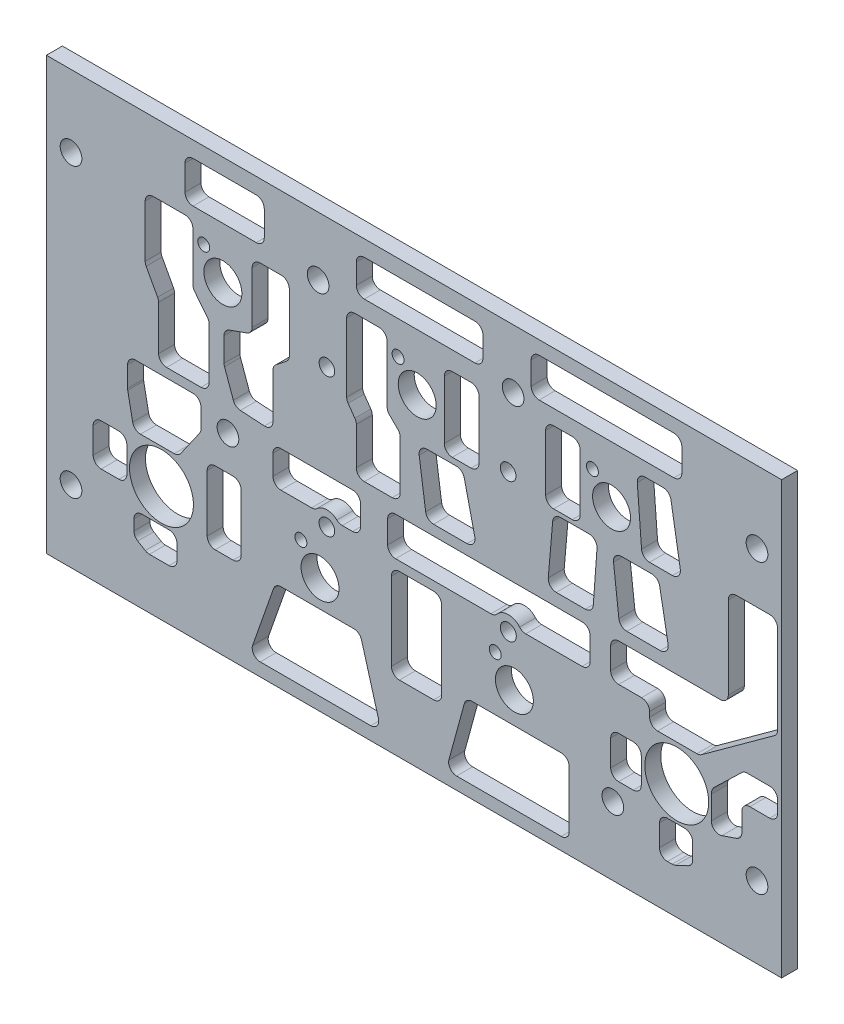
from build123d import *

# Parameters (mm, degrees)
SKETCH1_W                    = 146.05
SKETCH1_H                    = 85.725
BACKPLATE_BODY_DEPTH         = 3.175
F_6_CLEARANCE_HOLE1_D        = 4.3053
F_6_CLEARANCE_HOLE1_DEPTH    = 12.7
F_6_CLEARANCE_HOLE1_TIP      = 1.293442612
SKETCH4_R                    = 6.35
SKETCH4_R_2                  = 3.7703125
SKETCH4_R_3                  = 1.190625
SWITCH_MOUNT_HOLES_DEPTH     = 170.379629088
SKETCH6_R                    = 1.55
SKETCH6_R_2                  = 1.554753364
SKETCH6_R_3                  = 1.586123296
BACKLIGHTING_LED_HOLES_DEPTH = 170.379629088


with BuildPart() as part:
    # Sketch1 → Backplate Body (new body)
    with BuildSketch(Plane.XY):
        with Locations((-73.025, 42.8625)):
            Rectangle(SKETCH1_W, SKETCH1_H)
    extrude(amount=-BACKPLATE_BODY_DEPTH)

    # #6 Clearance Hole1
    with Locations(Plane(origin=(0, 0, -3.175), x_dir=(-1, 0, 0), z_dir=(0, 0, -1))):
        with Locations((4.8895, 71.4375), (53.34, 74.041), (92.075, 74.041), (141.1605, 71.4375), (109.982, 38.735), (141.1605, 14.2875), (33.528, 13.589), (4.8895, 14.2875)):
            Hole(F_6_CLEARANCE_HOLE1_D / 2, depth=F_6_CLEARANCE_HOLE1_DEPTH)
            with Locations((0, 0, -(F_6_CLEARANCE_HOLE1_DEPTH + F_6_CLEARANCE_HOLE1_TIP / 2))):  # 118° drill point
                Cone(0, F_6_CLEARANCE_HOLE1_D / 2, F_6_CLEARANCE_HOLE1_TIP, mode=Mode.SUBTRACT)

    # Sketch4 → Switch Mount Holes (cut, through all)
    with BuildSketch(Plane(origin=(0, 0, -3.175), x_dir=(-1, 0, 0), z_dir=(0, 0, -1))):
        with Locations((20.828, 22.987)):
            Circle(SKETCH4_R)
        with Locations((123.19, 22.987)):
            Circle(SKETCH4_R)
        with Locations((33.782, 64.135)):
            Circle(SKETCH4_R_2)
        with Locations((72.39, 64.135)):
            Circle(SKETCH4_R_2)
        with Locations((110.998, 64.135)):
            Circle(SKETCH4_R_2)
        with Locations((91.694, 22.987)):
            Circle(SKETCH4_R_2)
        with Locations((53.086, 22.987)):
            Circle(SKETCH4_R_2)
        with Locations((37.582285256, 68.778041242)):
            Circle(SKETCH4_R_3)
        with Locations((76.190285256, 68.778041242)):
            Circle(SKETCH4_R_3)
        with Locations((114.798285256, 68.778041242)):
            Circle(SKETCH4_R_3)
        with Locations((56.886285256, 27.630041242)):
            Circle(SKETCH4_R_3)
        with Locations((95.494285256, 27.630041242)):
            Circle(SKETCH4_R_3)
    extrude(amount=-SWITCH_MOUNT_HOLES_DEPTH, mode=Mode.SUBTRACT)

    # Sketch6 → Backlighting LED Holes (cut, through all)
    with BuildSketch(Plane(origin=(0, 0, -3.175), x_dir=(-1, 0, 0), z_dir=(0, 0, -1))):
        with Locations((90.3252, 59.937)):
            Circle(SKETCH6_R)
        with Locations((54.3252, 59.937)):
            Circle(SKETCH6_R)
        with Locations((90.329514846, 32.438994135)):
            Circle(SKETCH6_R_2)
        with Locations((54.290856695, 32.42580045)):
            Circle(SKETCH6_R_3)
        with BuildLine():
            Line((0.785426433, 59.749744345), (0.785426433, 42.262673755))
            ThreePointArc((0.785426433, 42.262673755), (0.958424834, 41.542020249), (1.439714906, 40.978433709))
            Line((1.439714906, 40.978433709), (15.887321534, 30.479872262))
            ThreePointArc((15.887321534, 30.479872262), (16.329908369, 30.254329655), (16.820533061, 30.176612309))
            Line((16.820533061, 30.176612309), (24.63882498, 30.176612309))
            ThreePointArc((24.63882498, 30.176612309), (25.761356995, 30.641580293), (26.22632498, 31.764112309))
            Line((26.22632498, 31.764112309), (26.22632498, 32.732935131))
            ThreePointArc((26.22632498, 32.732935131), (26.691292965, 33.855467146), (27.81382498, 34.320435131))
            Line((27.81382498, 34.320435131), (32.367304405, 34.320435131))
            ThreePointArc((32.367304405, 34.320435131), (33.48983642, 34.785403115), (33.954804405, 35.907935131))
            Line((33.954804405, 35.907935131), (33.954804405, 40.215556192))
            ThreePointArc((33.954804405, 40.215556192), (33.48983642, 41.338088207), (32.367304405, 41.803056192))
            Line((32.367304405, 41.803056192), (12.174303624, 41.803056192))
            ThreePointArc((12.174303624, 41.803056192), (11.051771609, 42.268024177), (10.586803624, 43.390556192))
            Line((10.586803624, 43.390556192), (10.586803624, 59.749744345))
            ThreePointArc((10.586803624, 59.749744345), (10.121835639, 60.872276361), (8.999303624, 61.337244345))
            Line((8.999303624, 61.337244345), (2.372926433, 61.337244345))
            ThreePointArc((2.372926433, 61.337244345), (1.250394418, 60.872276361), (0.785426433, 59.749744345))
        make_face()
        with BuildLine():
            Line((21.400023786, 75.350644356), (48.166754567, 75.350644356))
            ThreePointArc((48.166754567, 75.350644356), (49.289286582, 75.815612341), (49.754254567, 76.938144356))
            Line((49.754254567, 76.938144356), (49.754254567, 81.462446557))
            ThreePointArc((49.754254567, 81.462446557), (49.289286582, 82.584978572), (48.166754567, 83.049946557))
            Line((48.166754567, 83.049946557), (21.400023786, 83.049946557))
            ThreePointArc((21.400023786, 83.049946557), (20.277491771, 82.584978572), (19.812523786, 81.462446557))
            Line((19.812523786, 81.462446557), (19.812523786, 76.938144356))
            ThreePointArc((19.812523786, 76.938144356), (20.277491771, 75.815612341), (21.400023786, 75.350644356))
        make_face()
        with BuildLine():
            Line((59.335608416, 80.949159744), (59.335608416, 76.938144356))
            ThreePointArc((59.335608416, 76.938144356), (59.800576401, 75.815612341), (60.923108416, 75.350644356))
            Line((60.923108416, 75.350644356), (82.899162272, 75.350644356))
            ThreePointArc((82.899162272, 75.350644356), (84.021694287, 75.815612341), (84.486662272, 76.938144356))
            Line((84.486662272, 76.938144356), (84.486662272, 80.949159744))
            ThreePointArc((84.486662272, 80.949159744), (84.021694287, 82.071691759), (82.899162272, 82.536659744))
            Line((82.899162272, 82.536659744), (60.923108416, 82.536659744))
            ThreePointArc((60.923108416, 82.536659744), (59.800576401, 82.071691759), (59.335608416, 80.949159744))
        make_face()
        with BuildLine():
            Line((28.672038794, 70.907405635), (27.827187397, 59.864083676))
            ThreePointArc((27.827187397, 59.864083676), (27.323181945, 58.820620008), (26.244312737, 58.39767893))
            Line((26.244312737, 58.39767893), (21.689837718, 58.39767893))
            ThreePointArc((21.689837718, 58.39767893), (20.477644793, 58.960120608), (20.124397158, 60.248906253))
            Line((20.124397158, 60.248906253), (21.984848336, 71.292228211))
            ThreePointArc((21.984848336, 71.292228211), (22.525230575, 72.240693813), (23.550288897, 72.616000888))
            Line((23.550288897, 72.616000888), (27.089164134, 72.616000888))
            ThreePointArc((27.089164134, 72.616000888), (28.253723056, 72.107370096), (28.672038794, 70.907405635))
        make_face()
        with BuildLine():
            Line((46.876657313, 70.768971278), (46.876657313, 59.657488306))
            ThreePointArc((46.876657313, 59.657488306), (46.411689328, 58.534956291), (45.289157313, 58.069988306))
            Line((45.289157313, 58.069988306), (41.589305112, 58.069988306))
            ThreePointArc((41.589305112, 58.069988306), (40.466773097, 58.534956291), (40.001805112, 59.657488306))
            Line((40.001805112, 59.657488306), (40.001805112, 70.768971278))
            ThreePointArc((40.001805112, 70.768971278), (40.466773097, 71.891503293), (41.589305112, 72.356471278))
            Line((41.589305112, 72.356471278), (45.289157313, 72.356471278))
            ThreePointArc((45.289157313, 72.356471278), (46.411689328, 71.891503293), (46.876657313, 70.768971278))
        make_face()
        with BuildLine():
            Line((38.257624234, 57.278936968), (43.899609621, 57.278936968))
            ThreePointArc((43.899609621, 57.278936968), (44.972919639, 56.861121479), (45.481258886, 55.827605448))
            Line((45.481258886, 55.827605448), (46.355042782, 45.678269417))
            ThreePointArc((46.355042782, 45.678269417), (45.943078029, 44.46879092), (44.773393518, 43.954600938))
            Line((44.773393518, 43.954600938), (38.996979839, 43.954600938))
            ThreePointArc((38.996979839, 43.954600938), (37.915995587, 44.379505008), (37.413675408, 45.42676088))
            Line((37.413675408, 45.42676088), (36.674319803, 55.57609691))
            ThreePointArc((36.674319803, 55.57609691), (37.095028304, 56.77242122), (38.257624234, 57.278936968))
        make_face()
        with BuildLine():
            Line((24.219405423, 55.322692813), (22.548618943, 46.144830152))
            ThreePointArc((22.548618943, 46.144830152), (22.891532306, 44.843453603), (24.110449966, 44.273006203))
            Line((24.110449966, 44.273006203), (30.755280984, 44.273006203))
            ThreePointArc((30.755280984, 44.273006203), (31.811296344, 44.675184386), (32.3322486, 45.67794282))
            Line((32.3322486, 45.67794282), (33.394757201, 54.855805481))
            ThreePointArc((33.394757201, 54.855805481), (33.003111402, 56.094384224), (31.817789585, 56.625868864))
            Line((31.817789585, 56.625868864), (25.781236445, 56.625868864))
            ThreePointArc((25.781236445, 56.625868864), (24.764183846, 56.257286523), (24.219405423, 55.322692813))
        make_face()
        with BuildLine():
            Line((61.696291351, 71.619042996), (65.423676389, 71.619042996))
            ThreePointArc((65.423676389, 71.619042996), (66.546208404, 71.154075011), (67.011176389, 70.031542996))
            Line((67.011176389, 70.031542996), (67.011176389, 58.459819075))
            ThreePointArc((67.011176389, 58.459819075), (66.546208404, 57.337287059), (65.423676389, 56.872319075))
            Line((65.423676389, 56.872319075), (61.696291351, 56.872319075))
            ThreePointArc((61.696291351, 56.872319075), (60.573759336, 57.337287059), (60.108791351, 58.459819075))
            Line((60.108791351, 58.459819075), (60.108791351, 70.031542996))
            ThreePointArc((60.108791351, 70.031542996), (60.573759336, 71.154075011), (61.696291351, 71.619042996))
        make_face()
        with BuildLine():
            Line((78.368407935, 70.36568954), (78.368407935, 59.05524296))
            ThreePointArc((78.368407935, 59.05524296), (78.247566693, 58.447733011), (77.90343995, 57.932710945))
            Line((77.90343995, 57.932710945), (76.230642306, 56.259913301))
            ThreePointArc((76.230642306, 56.259913301), (75.886515563, 55.744891235), (75.765674321, 55.137381286))
            Line((75.765674321, 55.137381286), (75.765674321, 45.542100938))
            ThreePointArc((75.765674321, 45.542100938), (76.230642306, 44.419568923), (77.353174321, 43.954600938))
            Line((77.353174321, 43.954600938), (82.899162272, 43.954600938))
            ThreePointArc((82.899162272, 43.954600938), (84.021694287, 44.419568923), (84.486662272, 45.542100938))
            Line((84.486662272, 45.542100938), (84.486662272, 52.998183864))
            ThreePointArc((84.486662272, 52.998183864), (84.560211531, 53.475791866), (84.774044197, 53.909144479))
            Line((84.774044197, 53.909144479), (86.112563646, 55.819472215))
            ThreePointArc((86.112563646, 55.819472215), (86.326396312, 56.252824828), (86.399945571, 56.730432829))
            Line((86.399945571, 56.730432829), (86.399945571, 70.36568954))
            ThreePointArc((86.399945571, 70.36568954), (85.934977586, 71.488221555), (84.812445571, 71.95318954))
            Line((84.812445571, 71.95318954), (79.955907935, 71.95318954))
            ThreePointArc((79.955907935, 71.95318954), (78.83337592, 71.488221555), (78.368407935, 70.36568954))
        make_face()
        with BuildLine():
            Line((64.588095544, 55.752113711), (70.427150872, 55.752113711))
            ThreePointArc((70.427150872, 55.752113711), (71.625875842, 55.205389718), (71.998935675, 53.941793643))
            Line((71.998935675, 53.941793643), (70.710255392, 44.851373271))
            ThreePointArc((70.710255392, 44.851373271), (70.179246596, 43.875468368), (69.138470589, 43.486693338))
            Line((69.138470589, 43.486693338), (62.498343735, 43.486693338))
            ThreePointArc((62.498343735, 43.486693338), (61.256414725, 44.085371522), (60.951198538, 45.429858901))
            Line((60.951198538, 45.429858901), (63.040950348, 54.520279273))
            ThreePointArc((63.040950348, 54.520279273), (63.599273728, 55.406542721), (64.588095544, 55.752113711))
        make_face()
        with BuildLine():
            Line((104.361744188, 82.536659744), (116.930573023, 82.536659744))
            ThreePointArc((116.930573023, 82.536659744), (118.053105038, 82.071691759), (118.518073023, 80.949159744))
            Line((118.518073023, 80.949159744), (118.518073023, 75.923861258))
            ThreePointArc((118.518073023, 75.923861258), (118.053105038, 74.801329243), (116.930573023, 74.336361258))
            Line((116.930573023, 74.336361258), (104.361744188, 74.336361258))
            ThreePointArc((104.361744188, 74.336361258), (103.239212173, 74.801329243), (102.774244188, 75.923861258))
            Line((102.774244188, 75.923861258), (102.774244188, 80.949159744))
            ThreePointArc((102.774244188, 80.949159744), (103.239212173, 82.071691759), (104.361744188, 82.536659744))
        make_face()
        with BuildLine():
            Line((116.95152289, 70.450832848), (116.95152289, 60.794979539))
            ThreePointArc((116.95152289, 60.794979539), (116.861825101, 60.268914157), (116.602868041, 59.80229684))
            Line((116.602868041, 59.80229684), (114.088749966, 56.664735371))
            ThreePointArc((114.088749966, 56.664735371), (113.829792906, 56.198118054), (113.740095118, 55.672052672))
            Line((113.740095118, 55.672052672), (113.740095118, 45.542100938))
            ThreePointArc((113.740095118, 45.542100938), (114.205063103, 44.419568923), (115.327595118, 43.954600938))
            Line((115.327595118, 43.954600938), (122.178515967, 43.954600938))
            ThreePointArc((122.178515967, 43.954600938), (123.301047983, 44.419568923), (123.766015967, 45.542100938))
            Line((123.766015967, 45.542100938), (123.766015967, 54.374328078))
            ThreePointArc((123.766015967, 54.374328078), (123.814740935, 54.764619826), (123.957924816, 55.130953208))
            Line((123.957924816, 55.130953208), (126.237242345, 59.335142635))
            ThreePointArc((126.237242345, 59.335142635), (126.380426226, 59.701476017), (126.429151193, 60.091767765))
            Line((126.429151193, 60.091767765), (126.429151193, 70.450832848))
            ThreePointArc((126.429151193, 70.450832848), (125.964183208, 71.573364863), (124.841651193, 72.038332848))
            Line((124.841651193, 72.038332848), (118.53902289, 72.038332848))
            ThreePointArc((118.53902289, 72.038332848), (117.416490875, 71.573364863), (116.95152289, 70.450832848))
        make_face()
        with BuildLine():
            Line((105.172177173, 69.626168048), (105.172177173, 59.350951298))
            ThreePointArc((105.172177173, 59.350951298), (105.461527092, 58.437188409), (106.22409858, 57.856524378))
            Line((106.22409858, 57.856524378), (109.711728458, 56.606613876))
            ThreePointArc((109.711728458, 56.606613876), (110.474299946, 56.025949844), (110.763649865, 55.112186955))
            Line((110.763649865, 55.112186955), (110.763649865, 50.367987979))
            ThreePointArc((110.763649865, 50.367987979), (110.740208526, 50.096185189), (110.670576786, 49.832409386))
            Line((110.670576786, 49.832409386), (108.916673371, 44.938486226))
            ThreePointArc((108.916673371, 44.938486226), (108.375932915, 44.204955534), (107.520923995, 43.88963464))
            Line((107.520923995, 43.88963464), (102.737216586, 43.591707659))
            ThreePointArc((102.737216586, 43.591707659), (101.55145449, 44.019243969), (101.051039042, 45.176137838))
            Line((101.051039042, 45.176137838), (101.051039042, 54.014758396))
            ThreePointArc((101.051039042, 54.014758396), (100.894629541, 54.701880098), (100.456221741, 55.253603548))
            Line((100.456221741, 55.253603548), (98.391783299, 56.907831538))
            ThreePointArc((98.391783299, 56.907831538), (97.953375498, 57.459554988), (97.796965998, 58.146676689))
            Line((97.796965998, 58.146676689), (97.796965998, 69.626168048))
            ThreePointArc((97.796965998, 69.626168048), (98.261933983, 70.748700063), (99.384465998, 71.213668048))
            Line((99.384465998, 71.213668048), (103.584677173, 71.213668048))
            ThreePointArc((103.584677173, 71.213668048), (104.707209188, 70.748700063), (105.172177173, 69.626168048))
        make_face()
        with BuildLine():
            Line((39.626935681, 33.790848784), (50.842016714, 33.790848784))
            ThreePointArc((50.842016714, 33.790848784), (51.505798552, 33.936284319), (52.047958384, 34.34594337))
            ThreePointArc((52.047958384, 34.34594337), (54.290856695, 35.378348784), (56.533755006, 34.34594337))
            ThreePointArc((56.533755006, 34.34594337), (57.075914839, 33.936284319), (57.739696676, 33.790848784))
            Line((57.739696676, 33.790848784), (76.679009402, 33.790848784))
            ThreePointArc((76.679009402, 33.790848784), (77.801541417, 34.255816769), (78.266509402, 35.378348784))
            Line((78.266509402, 35.378348784), (78.266509402, 39.866381852))
            ThreePointArc((78.266509402, 39.866381852), (77.801541417, 40.988913867), (76.679009402, 41.453881852))
            Line((76.679009402, 41.453881852), (39.626935681, 41.453881852))
            ThreePointArc((39.626935681, 41.453881852), (38.504403665, 40.988913867), (38.039435681, 39.866381852))
            Line((38.039435681, 39.866381852), (38.039435681, 35.378348784))
            ThreePointArc((38.039435681, 35.378348784), (38.504403665, 34.255816769), (39.626935681, 33.790848784))
        make_face()
        with BuildLine():
            Line((83.642014846, 39.760843317), (83.642014846, 35.788315297))
            ThreePointArc((83.642014846, 35.788315297), (84.106982831, 34.665783282), (85.229514846, 34.200815297))
            Line((85.229514846, 34.200815297), (87.28411491, 34.200815297))
            ThreePointArc((87.28411491, 34.200815297), (87.856630207, 34.30764569), (88.352090972, 34.613758622))
            ThreePointArc((88.352090972, 34.613758622), (90.329514846, 35.378348784), (92.306938721, 34.613758622))
            ThreePointArc((92.306938721, 34.613758622), (92.802399486, 34.30764569), (93.374914782, 34.200815297))
            Line((93.374914782, 34.200815297), (99.463539042, 34.200815297))
            ThreePointArc((99.463539042, 34.200815297), (100.586071057, 34.665783282), (101.051039042, 35.788315297))
            Line((101.051039042, 35.788315297), (101.051039042, 39.760843317))
            ThreePointArc((101.051039042, 39.760843317), (100.586071057, 40.883375332), (99.463539042, 41.348343317))
            Line((99.463539042, 41.348343317), (85.229514846, 41.348343317))
            ThreePointArc((85.229514846, 41.348343317), (84.106982831, 40.883375332), (83.642014846, 39.760843317))
        make_face()
        with BuildLine():
            Line((115.345809004, 40.539297988), (115.345809004, 36.801804043))
            ThreePointArc((115.345809004, 36.801804043), (115.419245804, 36.324552666), (115.63276192, 35.891456015))
            Line((115.63276192, 35.891456015), (119.368084636, 30.555075958))
            ThreePointArc((119.368084636, 30.555075958), (119.93549505, 30.057351945), (120.66863172, 29.877923986))
            Line((120.66863172, 29.877923986), (127.357154785, 29.877923986))
            ThreePointArc((127.357154785, 29.877923986), (128.366421397, 30.240051734), (128.915236424, 31.161223633))
            Line((128.915236424, 31.161223633), (129.889388603, 36.150726788))
            ThreePointArc((129.889388603, 36.150726788), (129.911435258, 36.302117378), (129.918806964, 36.454927142))
            Line((129.918806964, 36.454927142), (129.918806964, 40.539297988))
            ThreePointArc((129.918806964, 40.539297988), (129.453838979, 41.661830003), (128.331306964, 42.126797988))
            Line((128.331306964, 42.126797988), (116.933309004, 42.126797988))
            ThreePointArc((116.933309004, 42.126797988), (115.810776989, 41.661830003), (115.345809004, 40.539297988))
        make_face()
        with BuildLine():
            Line((0.785426433, 30.234435945), (0.785426433, 27.901469923))
            ThreePointArc((0.785426433, 27.901469923), (1.250394418, 26.778937907), (2.372926433, 26.313969923))
            Line((2.372926433, 26.313969923), (6.315595781, 26.313969923))
            ThreePointArc((6.315595781, 26.313969923), (7.438127796, 25.849001938), (7.903095781, 24.726469923))
            Line((7.903095781, 24.726469923), (7.903095781, 21.040936804))
            ThreePointArc((7.903095781, 21.040936804), (8.199700392, 20.116953393), (8.978680466, 19.538239576))
            Line((8.978680466, 19.538239576), (11.871474027, 18.552768053))
            ThreePointArc((11.871474027, 18.552768053), (13.307372753, 18.764569892), (13.970889342, 20.055465281))
            Line((13.970889342, 20.055465281), (13.970889342, 24.657535192))
            ThreePointArc((13.970889342, 24.657535192), (13.805608325, 25.469507274), (13.336068845, 26.152258439))
            Line((13.336068845, 26.152258439), (7.921599209, 31.376823001))
            ThreePointArc((7.921599209, 31.376823001), (7.413677317, 31.706457633), (6.819279807, 31.821935945))
            Line((6.819279807, 31.821935945), (2.372926433, 31.821935945))
            ThreePointArc((2.372926433, 31.821935945), (1.250394418, 31.35696796), (0.785426433, 30.234435945))
        make_face()
        with BuildLine():
            Line((18.582773294, 10.016745037), (21.070326225, 8.857947088))
            ThreePointArc((21.070326225, 8.857947088), (21.397378928, 8.747033079), (21.74067813, 8.709469177))
            Line((21.74067813, 8.709469177), (22.673627884, 8.709469177))
            ThreePointArc((22.673627884, 8.709469177), (23.796159899, 9.174437162), (24.261127884, 10.296969177))
            Line((24.261127884, 10.296969177), (24.261127884, 14.547506632))
            ThreePointArc((24.261127884, 14.547506632), (23.796159899, 15.670038648), (22.673627884, 16.135006632))
            Line((22.673627884, 16.135006632), (19.253125199, 16.135006632))
            ThreePointArc((19.253125199, 16.135006632), (18.130593184, 15.670038648), (17.665625199, 14.547506632))
            Line((17.665625199, 14.547506632), (17.665625199, 11.455767126))
            ThreePointArc((17.665625199, 11.455767126), (17.91440568, 10.602545994), (18.582773294, 10.016745037))
        make_face()
        with BuildLine():
            Line((27.881901798, 24.309491603), (27.881901798, 19.183381997))
            ThreePointArc((27.881901798, 19.183381997), (28.346869783, 18.060849982), (29.469401798, 17.595881997))
            Line((29.469401798, 17.595881997), (32.367304405, 17.595881997))
            ThreePointArc((32.367304405, 17.595881997), (33.48983642, 18.060849982), (33.954804405, 19.183381997))
            Line((33.954804405, 19.183381997), (33.954804405, 24.309491603))
            ThreePointArc((33.954804405, 24.309491603), (33.48983642, 25.432023618), (32.367304405, 25.896991603))
            Line((32.367304405, 25.896991603), (29.469401798, 25.896991603))
            ThreePointArc((29.469401798, 25.896991603), (28.346869783, 25.432023618), (27.881901798, 24.309491603))
        make_face()
        with BuildLine():
            Line((43.779255464, 2.468354648), (64.568232739, 2.468354648))
            ThreePointArc((64.568232739, 2.468354648), (65.830132895, 3.092649454), (66.099531995, 4.474517804))
            Line((66.099531995, 4.474517804), (63.037286093, 15.674965732))
            ThreePointArc((63.037286093, 15.674965732), (62.469192031, 16.518202733), (61.505986837, 16.843802576))
            Line((61.505986837, 16.843802576), (43.779255464, 16.843802576))
            ThreePointArc((43.779255464, 16.843802576), (42.656723449, 16.378834591), (42.191755464, 15.256302576))
            Line((42.191755464, 15.256302576), (42.191755464, 4.055854648))
            ThreePointArc((42.191755464, 4.055854648), (42.656723449, 2.933322633), (43.779255464, 2.468354648))
        make_face()
        with BuildLine():
            Line((67.535901003, 30.388994135), (67.535901003, 14.880457769))
            ThreePointArc((67.535901003, 14.880457769), (68.000868988, 13.757925754), (69.123401003, 13.292957769))
            Line((69.123401003, 13.292957769), (75.929514846, 13.292957769))
            ThreePointArc((75.929514846, 13.292957769), (77.052046862, 13.757925754), (77.517014846, 14.880457769))
            Line((77.517014846, 14.880457769), (77.517014846, 30.388994135))
            ThreePointArc((77.517014846, 30.388994135), (77.052046862, 31.51152615), (75.929514846, 31.976494135))
            Line((75.929514846, 31.976494135), (69.123401003, 31.976494135))
            ThreePointArc((69.123401003, 31.976494135), (68.000868988, 31.51152615), (67.535901003, 30.388994135))
        make_face()
        with BuildLine():
            Line((83.450562292, 16.441087711), (80.100380971, 4.615416688))
            ThreePointArc((80.100380971, 4.615416688), (80.361462639, 3.225309301), (81.627771561, 2.595210974))
            Line((81.627771561, 2.595210974), (103.578012308, 2.595210974))
            ThreePointArc((103.578012308, 2.595210974), (104.873002433, 3.26447526), (105.076098837, 4.707966152))
            Line((105.076098837, 4.707966152), (100.929813014, 16.533637175))
            ThreePointArc((100.929813014, 16.533637175), (100.3499622, 17.303372121), (99.431726485, 17.595881997))
            Line((99.431726485, 17.595881997), (84.977952883, 17.595881997))
            ThreePointArc((84.977952883, 17.595881997), (84.020551209, 17.274690919), (83.450562292, 16.441087711))
        make_face()
        with BuildLine():
            Line((114.111100376, 30.264694353), (114.111100376, 18.998726199))
            ThreePointArc((114.111100376, 18.998726199), (113.646132392, 17.876194184), (112.523600376, 17.411226199))
            Line((112.523600376, 17.411226199), (108.961796592, 17.411226199))
            ThreePointArc((108.961796592, 17.411226199), (107.839264577, 17.876194184), (107.374296592, 18.998726199))
            Line((107.374296592, 18.998726199), (107.374296592, 30.264694353))
            ThreePointArc((107.374296592, 30.264694353), (107.839264577, 31.387226368), (108.961796592, 31.852194353))
            Line((108.961796592, 31.852194353), (112.523600376, 31.852194353))
            ThreePointArc((112.523600376, 31.852194353), (113.646132392, 31.387226368), (114.111100376, 30.264694353))
        make_face()
        with BuildLine():
            Line((130.071683152, 26.687660801), (130.071683152, 21.561325431))
            ThreePointArc((130.071683152, 21.561325431), (130.536651137, 20.438793415), (131.659183152, 19.973825431))
            Line((131.659183152, 19.973825431), (135.178450508, 19.973825431))
            ThreePointArc((135.178450508, 19.973825431), (136.300982523, 20.438793415), (136.765950508, 21.561325431))
            Line((136.765950508, 21.561325431), (136.765950508, 26.687660801))
            ThreePointArc((136.765950508, 26.687660801), (136.300982523, 27.810192817), (135.178450508, 28.275160801))
            Line((135.178450508, 28.275160801), (131.659183152, 28.275160801))
            ThreePointArc((131.659183152, 28.275160801), (130.536651137, 27.810192817), (130.071683152, 26.687660801))
        make_face()
        with BuildLine():
            Line((121.694193315, 16.253882812), (127.077184594, 16.253882812))
            ThreePointArc((127.077184594, 16.253882812), (128.199716609, 15.788914827), (128.664684594, 14.666382812))
            Line((128.664684594, 14.666382812), (128.664684594, 12.585143822))
            ThreePointArc((128.664684594, 12.585143822), (128.460825412, 11.806880154), (127.901605116, 11.228498307))
            Line((127.901605116, 11.228498307), (126.417136604, 10.326400971))
            ThreePointArc((126.417136604, 10.326400971), (126.020782371, 10.154349163), (125.592716082, 10.095546486))
            Line((125.592716082, 10.095546486), (121.694193315, 10.095546486))
            ThreePointArc((121.694193315, 10.095546486), (120.5716613, 10.56051447), (120.106693315, 11.683046486))
            Line((120.106693315, 11.683046486), (120.106693315, 14.666382812))
            ThreePointArc((120.106693315, 14.666382812), (120.5716613, 15.788914827), (121.694193315, 16.253882812))
        make_face()
    extrude(amount=-BACKLIGHTING_LED_HOLES_DEPTH, mode=Mode.SUBTRACT)


solid = part.part
